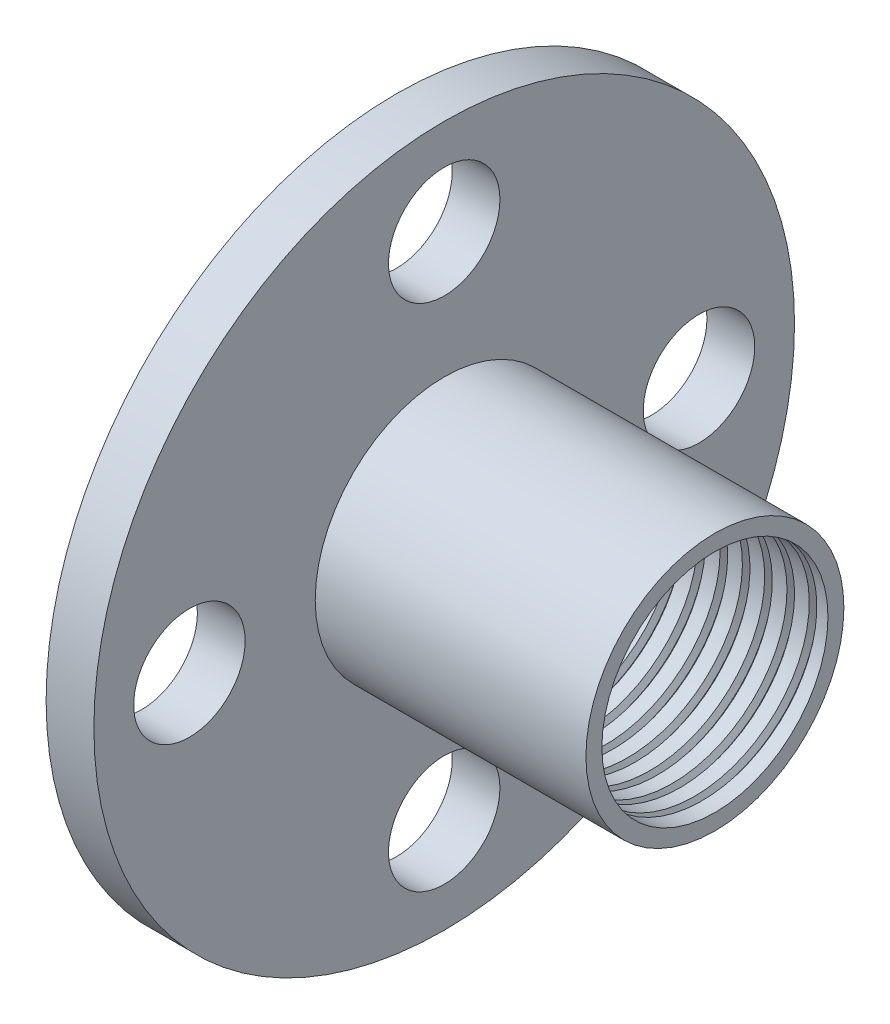
from build123d import *

# Parameters (mm, degrees)
SKETCH1_R           = 4.05
BOSS_EXTRUDE1_DEPTH = 10
SKETCH1_3_R         = 11
SKETCH1_3_R_2       = 4.05
SKETCH1_3_R_3       = 1.75
BOSS_EXTRUDE2_DEPTH = 1.5
SHELL2_T            = -0.5
THREAD1_PITCH       = 0.7


with BuildPart() as part:
    # Sketch1 → Boss-Extrude1 (new body)
    with BuildSketch(Plane(origin=(0, 0, 0), x_dir=(0, 0, -1), z_dir=(1, 0, 0))):
        Circle(SKETCH1_R)
    extrude(amount=BOSS_EXTRUDE1_DEPTH)

    # Shell2
    shell2_openings = [part.faces().sort_by_distance(p)[0] for p in [
        (0, 0, 0),
        (10, 0, 0),
    ]]
    offset(amount=SHELL2_T, openings=shell2_openings, kind=Kind.INTERSECTION)

    # Thread1: the profile of Thread Profile1 profile screwed along a right-hand helix of 14.285714 turns, 6 arcs to a turn; built about Z, then put on its axis
    thread1_z = Axis((0, 0, 0), (0, 0, 1))
    thread1_corners = [(3.5497, 0, -0.000173205), (3.721851915, 0, 0.09921875), (3.721851915, 0, 0.13890625), (3.5497, 0, 0.238298204)]
    with BuildLine(mode=Mode.PRIVATE) as thread1_profile:
        Line(thread1_corners[0], thread1_corners[1])
        Line(thread1_corners[1], thread1_corners[2])
        Line(thread1_corners[2], thread1_corners[3])
        Line(thread1_corners[3], thread1_corners[0])
    thread1_cap = Face(thread1_profile.wire())
    thread1_turn_angles = [0, 30, 60, 90, 120, 150, 180, 210, 240, 270, 300, 330, 360]
    thread1_turn_weights = [1, 0.8660254037844387, 1, 0.8660254037844387, 1, 0.8660254037844387, 1, 0.8660254037844387, 1, 0.8660254037844387, 1, 0.8660254037844387, 1]
    thread1_turn_rails = [Edge.make_bspline([Vector(p[0], p[1], 0).rotate(thread1_z, thread1_turn_angles[k]) / thread1_turn_weights[k] + Vector(0, 0, p[2] + THREAD1_PITCH * thread1_turn_angles[k] / 360) for k in range(13)], [0, 0, 0, 1, 1, 2, 2, 3, 3, 4, 4, 5, 5, 6, 6, 6], 2, thread1_turn_weights) for p in thread1_corners]
    thread1_turn_sides = [Face.make_surface_from_curves(thread1_turn_rails[p[0]], thread1_turn_rails[p[1]]) for p in [(0, 1), (1, 2), (2, 3), (3, 0)]]
    thread1_last_angles = [5040, 5070, 5100, 5121.428571429, 5142.857142857]
    thread1_last_weights = [1, 0.8660254037844387, 1, 0.9308737486442035, 1]
    thread1_last_rails = [Edge.make_bspline([Vector(p[0], p[1], 0).rotate(thread1_z, thread1_last_angles[k]) / thread1_last_weights[k] + Vector(0, 0, p[2] + THREAD1_PITCH * thread1_last_angles[k] / 360) for k in range(5)], [0, 0, 0, 1, 1, 2, 2, 2], 2, thread1_last_weights) for p in thread1_corners]
    thread1_last_sides = [Face.make_surface_from_curves(thread1_last_rails[p[0]], thread1_last_rails[p[1]]) for p in [(0, 1), (1, 2), (2, 3), (3, 0)]]
    thread1 = Plane(origin=(10, 0, 0), x_dir=(0, 0, 1), z_dir=(-1, 0, 0)) * Solid(Shell([*[p.moved(Location((0, 0, THREAD1_PITCH * i))) for i in range(14) for p in thread1_turn_sides], *thread1_last_sides, thread1_cap, thread1_cap.rotate(thread1_z, 5142.857142857).moved(Location((0, 0, THREAD1_PITCH * 5142.857142857 / 360)))]))
    add(thread1, mode=Mode.SUBTRACT)


with BuildPart() as body_2:
    # Sketch1<3> → Boss-Extrude2 (new body)
    with BuildSketch(Plane(origin=(0, 0, 0), x_dir=(0, 0, -1), z_dir=(1, 0, 0))):
        Circle(SKETCH1_3_R)
        Circle(SKETCH1_3_R_2, mode=Mode.SUBTRACT)
        with Locations((0, 8)):
            Circle(SKETCH1_3_R_3, mode=Mode.SUBTRACT)
        with Locations((8, 0)):
            Circle(SKETCH1_3_R_3, mode=Mode.SUBTRACT)
        with Locations((0, -8)):
            Circle(SKETCH1_3_R_3, mode=Mode.SUBTRACT)
        with Locations((-8, 0)):
            Circle(SKETCH1_3_R_3, mode=Mode.SUBTRACT)
    extrude(amount=BOSS_EXTRUDE2_DEPTH)


solid = Compound([part.part, body_2.part])
